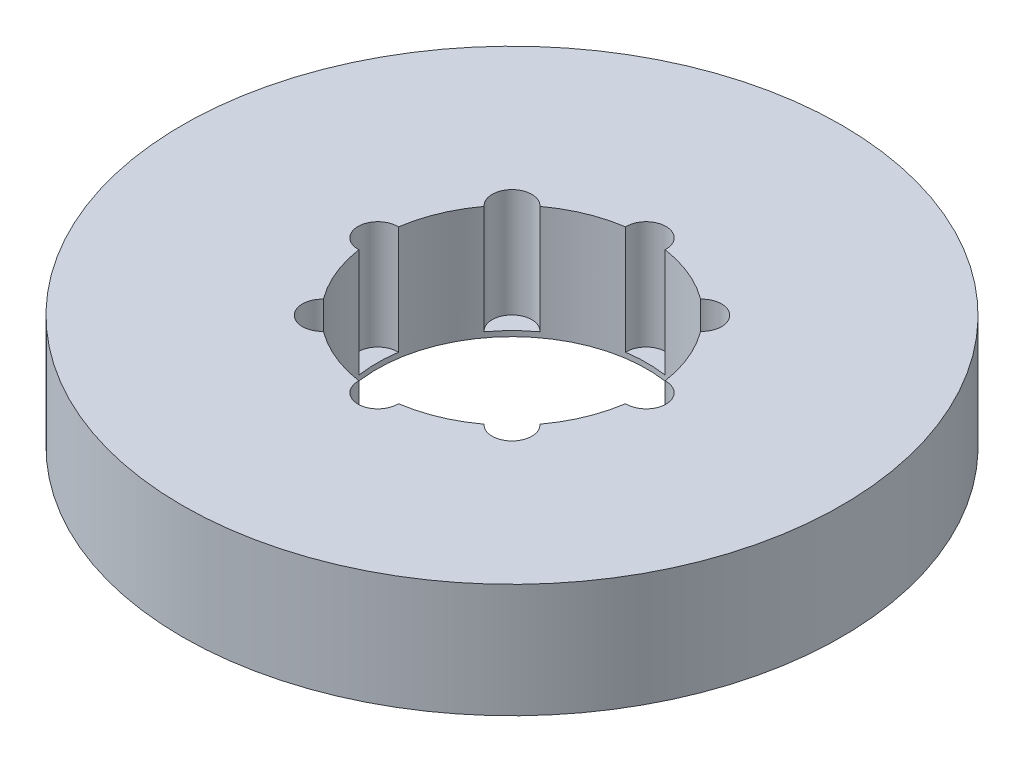
from build123d import *

# Parameters (mm, degrees)
SKETCH1_R           = 55
BOSS_EXTRUDE1_DEPTH = 19
SKETCH2_R           = 22.5
CUT_EXTRUDE1_DEPTH  = 81.068720484
SKETCH3_R           = 3.301101722
CUT_EXTRUDE2_DEPTH  = 18.121735886
CIRPATTERN1_COUNT   = 8


with BuildPart() as part:
    # Sketch1 → Boss-Extrude1 (new body)
    with BuildSketch(Plane(origin=(0, 0, 0), x_dir=(1, 0, 0), z_dir=(0, 1, 0))):
        Circle(SKETCH1_R)
    extrude(amount=BOSS_EXTRUDE1_DEPTH)

    # Sketch2 → Cut-Extrude1 (cut, through all)
    with BuildSketch(Plane(origin=(0, 0, 0), x_dir=(1, 0, 0), z_dir=(0, 1, 0))):
        Circle(SKETCH2_R)
    extrude(amount=CUT_EXTRUDE1_DEPTH, mode=Mode.SUBTRACT)

    # Sketch3 → Cut-Extrude2 (cut)
    with BuildSketch(Plane(origin=(0, 19, 0), x_dir=(1, 0, 0), z_dir=(0, 1, 0))):
        with Locations((-22.39262262, 0)):
            Circle(SKETCH3_R)
    cut_extrude2 = extrude(amount=-CUT_EXTRUDE2_DEPTH, mode=Mode.SUBTRACT)

    # CirPattern1: Cut-Extrude2 ×8 about axis
    cirpattern1_axis = Axis((0, 0, 0), (0, 1, 0))
    for i in range(1, CIRPATTERN1_COUNT):
        add(cut_extrude2.rotate(cirpattern1_axis, i * 360 / CIRPATTERN1_COUNT), mode=Mode.SUBTRACT)


solid = part.part
